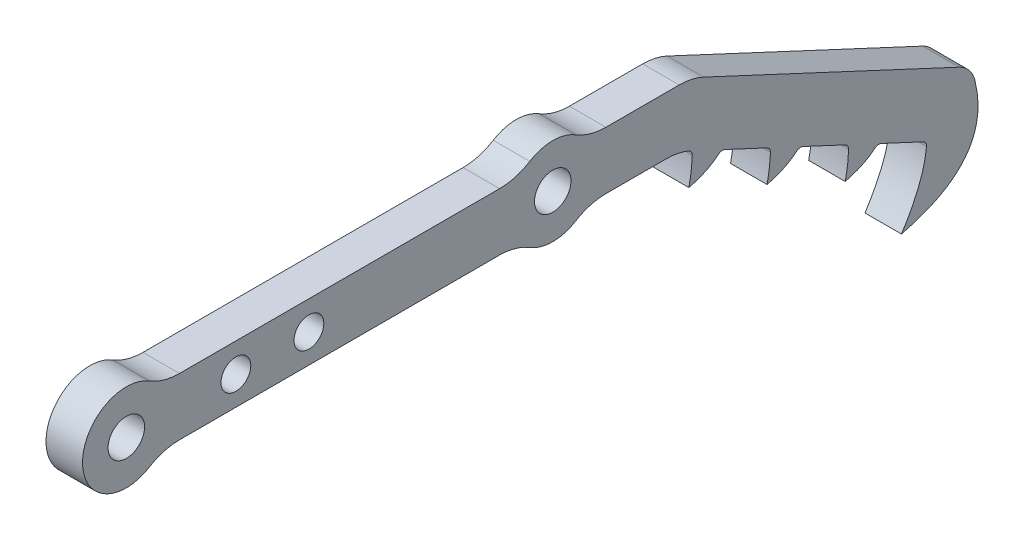
from build123d import *

# Parameters (mm, degrees)
BOSS_EXTRUDE1_DEPTH        = 6.35
F_1_4_0_2500_DOWEL_HOLE4_D = 6.35
FILLET1_R                  = 10
FILLET2_R                  = 10
FILLET4_R                  = 5
FILLET5_R                  = 1
FILLET6_R                  = 10
F_6_0_204_DIAMETER_HOLE1_D = 5.1816


with BuildPart() as part:
    # Sketch1 → Boss-Extrude1 (new body)
    with BuildSketch(Plane(origin=(0, 0, 0), x_dir=(0, 0, -1), z_dir=(1, 0, 0))):
        with BuildLine():
            Line((-34.29915969, 49.86223243), (28.354545267, 49.86223243))
            ThreePointArc((28.354545267, 49.86223243), (34.104710482, 47.24223243), (39.854875697, 49.86223243))
            Line((39.854875697, 49.86223243), (56.104710487, 49.86223243))
            Line((56.104710487, 49.86223243), (58.379362515, 48.80154477))
            add(Edge.make_bspline(
                [(58.379362515, 48.80154477), (58.386228757, 46.363071997), (57.773854653, 43.567008128)],
                knots=[0, 0, 0, 1, 1, 1], degree=2))
            add(Edge.make_bspline(
                [(63.433148606, 46.444925613), (61.354068213, 44.407555536), (57.773854653, 43.567008128)],
                knots=[0.61808465, 0.61808465, 0.61808465, 1, 1, 1], degree=2))
            Line((63.433148606, 46.444925613), (71.973979321, 42.462270844))
            add(Edge.make_bspline(
                [(71.973979321, 42.462270844), (71.980845562, 40.023798071), (71.368471459, 37.227734202)],
                knots=[0, 0, 0, 1, 1, 1], degree=2))
            add(Edge.make_bspline(
                [(77.027765412, 40.105651687), (74.948685018, 38.06828161), (71.368471459, 37.227734202)],
                knots=[0.61808465, 0.61808465, 0.61808465, 1, 1, 1], degree=2))
            Line((77.027765412, 40.105651687), (85.568596126, 36.122996918))
            add(Edge.make_bspline(
                [(85.568596126, 36.122996918), (85.575462368, 33.684524145), (84.963088264, 30.888460276)],
                knots=[0, 0, 0, 1, 1, 1], degree=2))
            add(Edge.make_bspline(
                [(90.622382217, 33.766377761), (88.543301824, 31.729007684), (84.963088264, 30.888460276)],
                knots=[0.61808465, 0.61808465, 0.61808465, 1, 1, 1], degree=2))
            Line((90.622382217, 33.766377761), (99.163212932, 29.783722992))
            add(Edge.make_bspline(
                [(99.163212932, 29.783722992), (98.939072146, 24.65005498), (94.755179462, 18.075155142)],
                knots=[0, 0, 0, 1, 1, 1], degree=2))
            add(Edge.make_bspline(
                [(94.755179462, 18.075155142), (112.208752339, 22.33534385), (106.773416656, 37.268805905)],
                knots=[0.444949083, 0.444949083, 0.444949083, 1.444949083, 1.444949083, 1.444949083], degree=2))
            Line((106.773416656, 37.268805905), (58.321657114, 59.86223243))
            Line((58.321657114, 59.86223243), (39.854875697, 59.86223243))
            ThreePointArc((39.854875697, 59.86223243), (34.104710482, 62.48223243), (28.354545266, 59.86223243))
            Line((28.354545266, 59.86223243), (-34.29915969, 59.86223243))
            ThreePointArc((-34.29915969, 59.86223243), (-47.669324906, 54.86223243), (-34.29915969, 49.86223243))
        make_face()
    extrude(amount=BOSS_EXTRUDE1_DEPTH)

    # 1/4 (0.2500) Dowel Hole4 (through all)
    with Locations(Plane(origin=(6.35, 0, 0), x_dir=(0, 0, -1), z_dir=(1, 0, 0))):
        with Locations((-40.049324906, 54.86223243), (34.104710482, 54.86223243)):
            Hole(F_1_4_0_2500_DOWEL_HOLE4_D / 2)

    # Fillet1
    fillet1_edges = [part.edges().sort_by_distance(p)[0] for p in [
        (3.175, 59.86223243, 34.29915969),
        (3.175, 49.86223243, 34.29915969),
    ]]
    fillet(fillet1_edges, radius=FILLET1_R)

    # Fillet2
    fillet2_edges = [part.edges().sort_by_distance(p)[0] for p in [
        (3.175, 49.86223243, -56.104710487),
        (3.175, 59.86223243, -58.321657114),
    ]]
    fillet(fillet2_edges, radius=FILLET2_R)

    # Fillet4
    fillet4_edges = [part.edges().sort_by_distance(p)[0] for p in [
        (3.175, 37.268805905, -106.773416656),
    ]]
    fillet(fillet4_edges, radius=FILLET4_R)

    # Fillet5
    fillet5_edges = [part.edges().sort_by_distance(p)[0] for p in [
        (3.175, 33.766377761, -90.622382217),
        (3.175, 40.105651687, -77.027765412),
        (3.175, 46.444925613, -63.433148606),
        (3.175, 48.80154477, -58.379362515),
        (3.175, 42.462270844, -71.973979321),
        (3.175, 36.122996918, -85.568596126),
        (3.175, 29.783722992, -99.163212932),
    ]]
    fillet(fillet5_edges, radius=FILLET5_R)

    # Fillet6
    fillet6_edges = [part.edges().sort_by_distance(p)[0] for p in [
        (3.175, 49.86223243, -28.354545267),
        (3.175, 49.86223243, -39.854875697),
        (3.175, 59.86223243, -28.354545266),
        (3.175, 59.86223243, -39.854875697),
    ]]
    fillet(fillet6_edges, radius=FILLET6_R)

    # #6 (0.204) Diameter Hole1 (through all)
    with Locations(Plane(origin=(6.35, 0, 0), x_dir=(0, 0, -1), z_dir=(1, 0, 0))):
        with Locations((-20.999324906, 54.86223243), (-8.299324906, 54.86223243)):
            Hole(F_6_0_204_DIAMETER_HOLE1_D / 2)


solid = part.part
